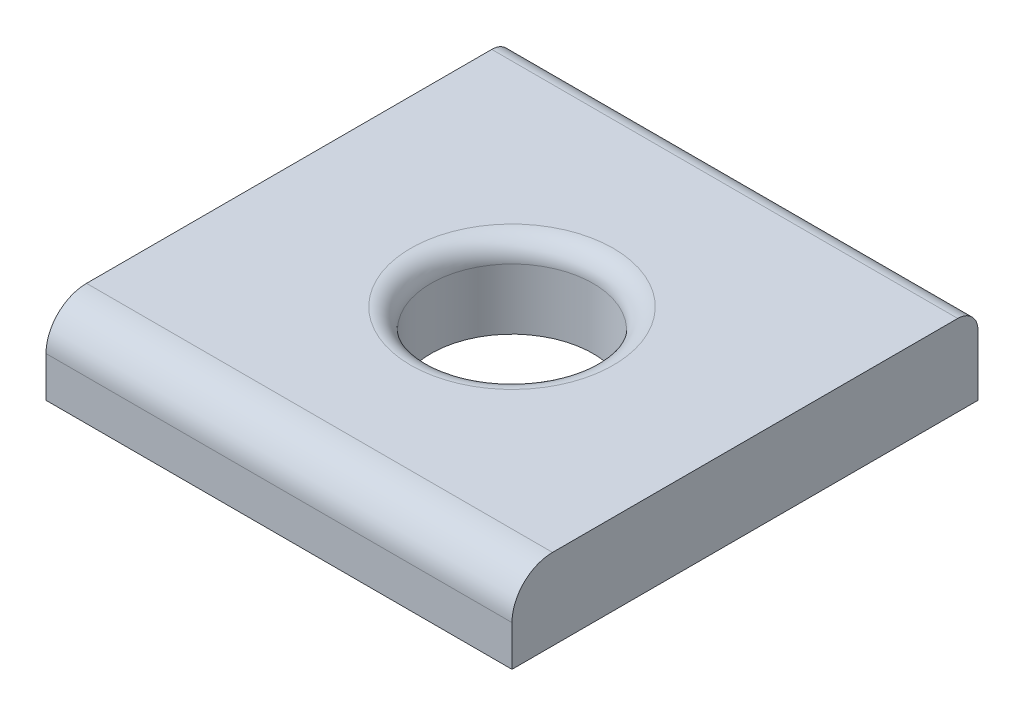
from build123d import *

# Parameters (mm, degrees)
SKETCH1_W           = 11.5
SKETCH1_H           = 11.5
BOSS_EXTRUDE1_DEPTH = 2
SKETCH2_R           = 2
CUT_EXTRUDE1_DEPTH  = 9.374067112
FILLET1_R           = 1
FILLET2_R           = 0.5
FILLET3_R           = 0.5


with BuildPart() as part:
    # Sketch1 → Boss-Extrude1 (new body)
    with BuildSketch(Plane(origin=(0, 0, 0), x_dir=(1, 0, 0), z_dir=(0, 1, 0))):
        Rectangle(SKETCH1_W, SKETCH1_H)
    extrude(amount=BOSS_EXTRUDE1_DEPTH)

    # Sketch2 → Cut-Extrude1 (cut, through all)
    with BuildSketch(Plane(origin=(0, 2, 0), x_dir=(1, 0, 0), z_dir=(0, 1, 0))):
        Circle(SKETCH2_R)
    extrude(amount=-CUT_EXTRUDE1_DEPTH, mode=Mode.SUBTRACT)

    # Fillet1
    fillet1_edges = [part.edges().sort_by_distance(p)[0] for p in [
        (0, 2, 5.75),
    ]]
    fillet(fillet1_edges, radius=FILLET1_R)

    # Fillet2
    fillet2_edges = [part.edges().sort_by_distance(p)[0] for p in [
        (0, 2, -5.75),
    ]]
    fillet(fillet2_edges, radius=FILLET2_R)

    # Fillet3
    fillet3_edges = [part.edges().sort_by_distance(p)[0] for p in [
        (-2, 2, 0),
    ]]
    fillet(fillet3_edges, radius=FILLET3_R)


solid = part.part
